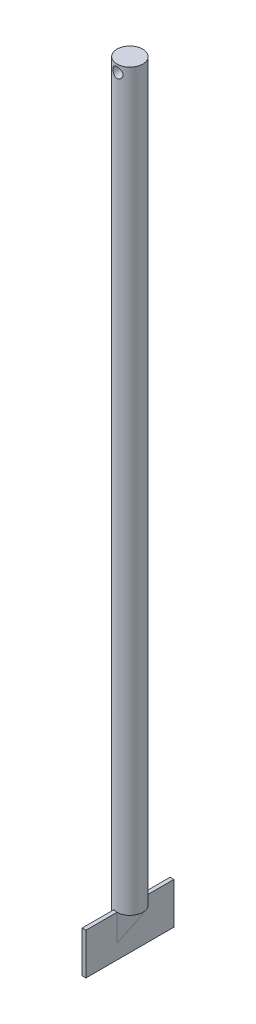
from build123d import *

# Parameters (mm, degrees)
SKETCH1_R               = 2.5
BOSS_EXTRUDE1_DEPTH     = 150
CUT_EXTRUDE1_DEPTH      = 8
BASE_FLANGE1_DEPTH      = 0.7366
CUT_EXTRUDE2_DEPTH      = 151.261438832
CUT_EXTRUDE2_DEPTH_BACK = 151.261438832
SKETCH9_R               = 0.976503682


# Sheet-metal steps are written as plain solids
with BuildPart() as part:
    # Sketch1 → Boss-Extrude1 (new body)
    with BuildSketch(Plane(origin=(0, 0, 0), x_dir=(1, 0, 0), z_dir=(0, 1, 0))):
        with Locations(Location((0, 0, 0), (0, 0, 270))):
            Circle(SKETCH1_R)
    extrude(amount=BOSS_EXTRUDE1_DEPTH)

    # Sketch2 → Cut-Extrude1 (cut)
    with BuildSketch(Plane.XZ):
        with BuildLine():
            Line((0, -2.5), (0, 2.5))
            ThreePointArc((0, 2.5), (2.5, 0), (0, -2.5))
        make_face()
    extrude(amount=-CUT_EXTRUDE1_DEPTH, mode=Mode.SUBTRACT)

    # Sketch9 → Cut-Extrude2 (cut, two sides: drawn at the far end of the back side and taken through both)
    with BuildSketch(Plane.XY.offset(-CUT_EXTRUDE2_DEPTH_BACK)):
        with Locations((0, 148.569798757)):
            Circle(SKETCH9_R)
    extrude(amount=CUT_EXTRUDE2_DEPTH + CUT_EXTRUDE2_DEPTH_BACK, mode=Mode.SUBTRACT)


with BuildPart() as body_2:
    # Sketch4 → Base-Flange1 (new body)
    with BuildSketch(Plane(origin=(0, 0, 0), x_dir=(0, 0, -1), z_dir=(1, 0, 0))):
        Polygon((-2.5, 8), (-8.5, 8), (-8.5, 0), (-2.5, 0), (2.5, 0), (8.5, 0), (8.5, 8), (2.5, 8), align=None)
    extrude(amount=-BASE_FLANGE1_DEPTH)


solid = Compound([part.part, body_2.part])
